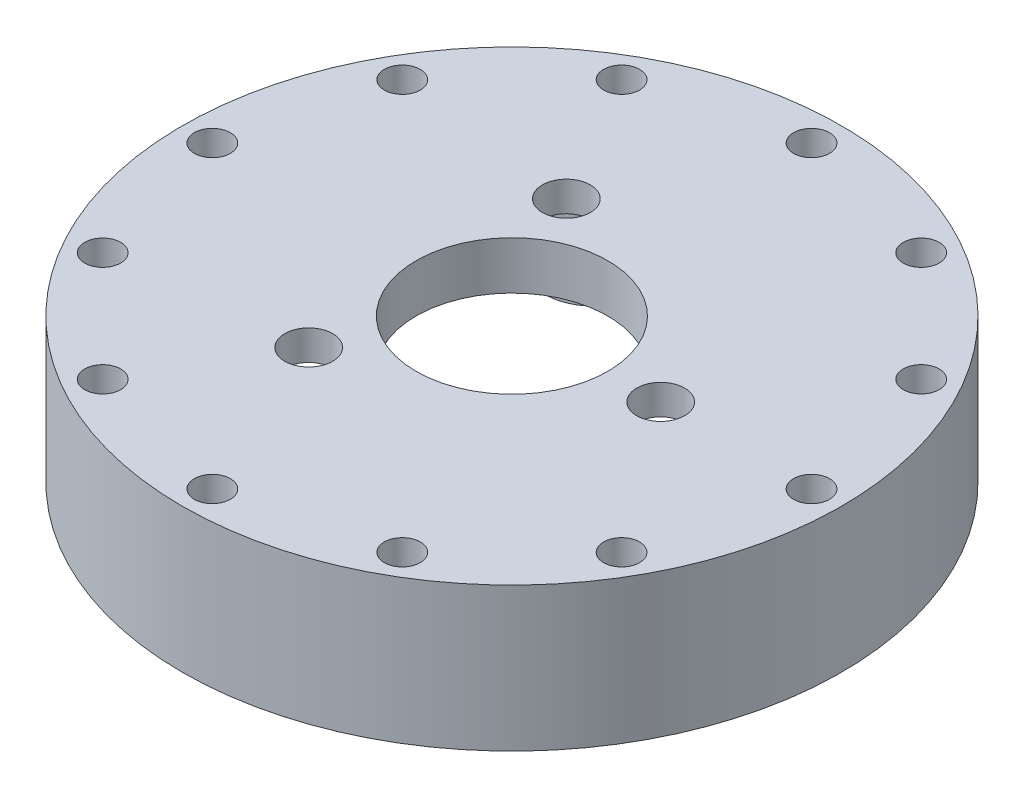
from build123d import *

# Parameters (mm, degrees)
SKETCH1_R           = 27.5
BOSS_EXTRUDE2_DEPTH = 8
SKETCH2_R           = 27.5
SKETCH2_R_2         = 8
SKETCH2_R_3         = 2
BOSS_EXTRUDE3_DEPTH = 4
FILLET2_R           = 1
SKETCH8_R           = 1.5
CUT_EXTRUDE1_DEPTH  = 41.700122985
SKETCH9_R           = 4.25
CUT_EXTRUDE2_DEPTH  = 1.5


with BuildPart() as part:
    # Sketch1 → Boss-Extrude2 (new body)
    with BuildSketch(Plane(origin=(0, 0, 0), x_dir=(1, 0, 0), z_dir=(0, 1, 0))):
        Circle(SKETCH1_R)
        with BuildLine():
            ThreePointArc((22.486051897, 0.792130095), (18.311696675, -2.632824508), (21.352039962, -7.095096155))
            ThreePointArc((21.352039962, -7.095096155), (20.466719895, -9.346837793), (19.34472846, -11.490495238))
            ThreePointArc((19.34472846, -11.490495238), (13.981367126, -12.114923578), (14.126580466, -17.512559046))
            ThreePointArc((14.126580466, -17.512559046), (12.164418393, -18.928204489), (10.06159042, -20.124969521))
            ThreePointArc((10.06159042, -20.124969521), (5.212052302, -17.750620012), (2.416031486, -22.369908177))
            ThreePointArc((2.416031486, -22.369908177), (0, -22.5), (-2.416031486, -22.369908177))
            ThreePointArc((-2.416031486, -22.369908177), (-5.212052302, -17.750620012), (-10.06159042, -20.124969521))
            ThreePointArc((-10.06159042, -20.124969521), (-12.164418393, -18.928204489), (-14.126580466, -17.512559046))
            ThreePointArc((-14.126580466, -17.512559046), (-13.981367126, -12.114923578), (-19.34472846, -11.490495238))
            ThreePointArc((-19.34472846, -11.490495238), (-20.466719895, -9.346837793), (-21.352039962, -7.095096155))
            ThreePointArc((-21.352039962, -7.095096155), (-18.311696675, -2.632824508), (-22.486051897, 0.792130095))
            ThreePointArc((-22.486051897, 0.792130095), (-22.270982442, 3.202083861), (-21.798377637, 5.575009634))
            ThreePointArc((-21.798377637, 5.575009634), (-16.828191914, 7.685177741), (-18.488212735, 12.82325972))
            ThreePointArc((-18.488212735, 12.82325972), (-17.004365423, 14.734366514), (-15.323884431, 16.475089254))
            ThreePointArc((-15.323884431, 16.475089254), (-10.001855123, 15.563190357), (-8.620496662, 20.783094988))
            ThreePointArc((-8.620496662, 20.783094988), (-6.338982529, 21.588591906), (-3.984166192, 22.144444444))
            ThreePointArc((-3.984166192, 22.144444444), (0, 18.5), (3.984166192, 22.144444444))
            ThreePointArc((3.984166192, 22.144444444), (6.338982529, 21.588591906), (8.620496662, 20.783094988))
            ThreePointArc((8.620496662, 20.783094988), (10.001855123, 15.563190357), (15.323884431, 16.475089254))
            ThreePointArc((15.323884431, 16.475089254), (17.004365423, 14.734366514), (18.488212735, 12.82325972))
            ThreePointArc((18.488212735, 12.82325972), (16.828191914, 7.685177741), (21.798377637, 5.575009634))
            ThreePointArc((21.798377637, 5.575009634), (22.270982442, 3.202083861), (22.486051897, 0.792130095))
        make_face(mode=Mode.SUBTRACT)
    extrude(amount=BOSS_EXTRUDE2_DEPTH)

    # Sketch2 → Boss-Extrude3 (add)
    with BuildSketch(Plane(origin=(0, 8, 0), x_dir=(1, 0, 0), z_dir=(0, 1, 0))):
        Circle(SKETCH2_R)
        Circle(SKETCH2_R_2, mode=Mode.SUBTRACT)
        with Locations((-6.206515394, 10.75)):
            Circle(SKETCH2_R_3, mode=Mode.SUBTRACT)
        with Locations((12.413030788, 0)):
            Circle(SKETCH2_R_3, mode=Mode.SUBTRACT)
        with Locations((-6.206515394, -10.75)):
            Circle(SKETCH2_R_3, mode=Mode.SUBTRACT)
    extrude(amount=BOSS_EXTRUDE3_DEPTH)

    # Fillet2
    fillet2_edges = [part.edges().sort_by_distance(p)[0] for p in [
        (19.34472846, 4, 11.490495238),
        (10.06159042, 4, 20.124969521),
        (2.416031486, 4, 22.369908177),
        (14.126580466, 4, 17.512559046),
        (-2.416031486, 4, 22.369908177),
        (-10.06159042, 4, 20.124969521),
        (-14.126580466, 4, 17.512559046),
        (-19.34472846, 4, 11.490495238),
        (-21.352039962, 4, 7.095096155),
        (-22.486051897, 4, -0.792130095),
        (-21.798377637, 4, -5.575009634),
        (-18.488212735, 4, -12.82325972),
        (-15.323884431, 4, -16.475089254),
        (-8.620496662, 4, -20.783094988),
        (-3.984166192, 4, -22.144444444),
        (3.984166192, 4, -22.144444444),
        (8.620496662, 4, -20.783094988),
        (15.323884431, 4, -16.475089254),
        (18.488212735, 4, -12.82325972),
        (21.798377637, 4, -5.575009634),
        (22.486051897, 4, -0.792130095),
        (21.352039962, 4, 7.095096155),
    ]]
    fillet(fillet2_edges, radius=FILLET2_R)

    # Sketch8 → Cut-Extrude1 (cut, through all)
    with BuildSketch(Plane.XZ):
        with Locations((0, -25)):
            Circle(SKETCH8_R)
        with Locations((-12.5, -21.650635095)):
            Circle(SKETCH8_R)
        with Locations((-21.650635095, -12.5)):
            Circle(SKETCH8_R)
        with Locations((-25, 0)):
            Circle(SKETCH8_R)
        with Locations((-21.650635095, 12.5)):
            Circle(SKETCH8_R)
        with Locations((-12.5, 21.650635095)):
            Circle(SKETCH8_R)
        with Locations((0, 25)):
            Circle(SKETCH8_R)
        with Locations((12.5, 21.650635095)):
            Circle(SKETCH8_R)
        with Locations((21.650635095, 12.5)):
            Circle(SKETCH8_R)
        with Locations((25, 0)):
            Circle(SKETCH8_R)
        with Locations((21.650635095, -12.5)):
            Circle(SKETCH8_R)
        with Locations((12.5, -21.650635095)):
            Circle(SKETCH8_R)
    extrude(amount=-CUT_EXTRUDE1_DEPTH, mode=Mode.SUBTRACT)

    # Sketch9 → Cut-Extrude2 (cut)
    with BuildSketch(Plane.XZ.offset(-8)):
        with Locations((12.413030788, 0)):
            Circle(SKETCH9_R)
        with Locations((-6.206515394, -10.75)):
            Circle(SKETCH9_R)
        with Locations((-6.206515394, 10.75)):
            Circle(SKETCH9_R)
    extrude(amount=-CUT_EXTRUDE2_DEPTH, mode=Mode.SUBTRACT)


solid = part.part
